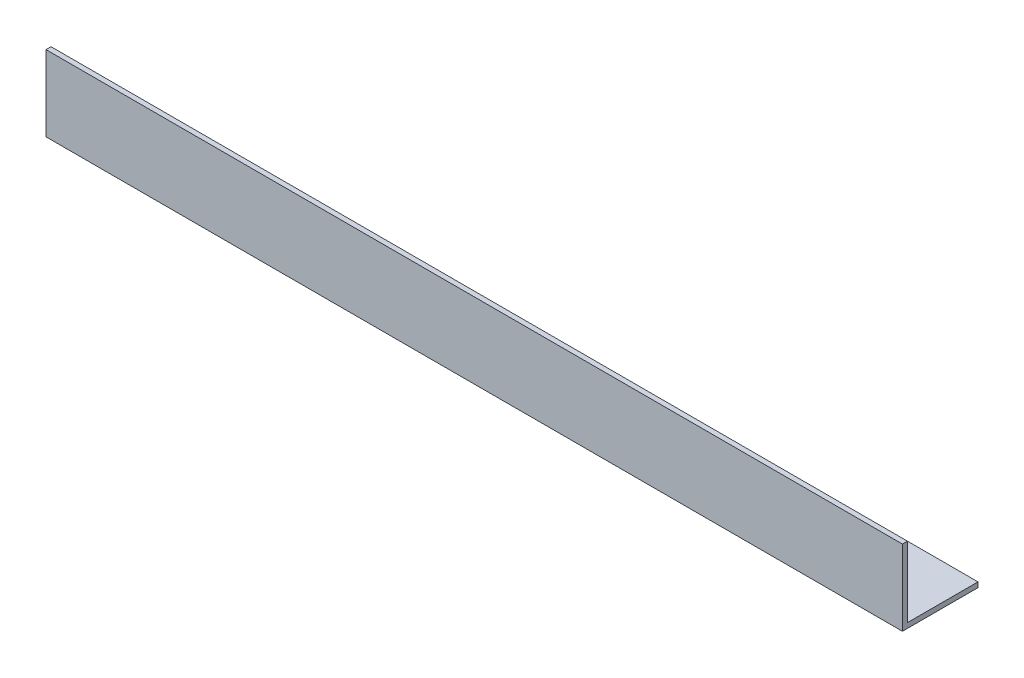
from build123d import *

# Parameters (mm, degrees)
EXTRUDE_1_DEPTH = 510


with BuildPart() as part:
    # Эскиз1 → Вытянуть-Тонкостенный1 (new body)
    with BuildSketch(Plane(origin=(0, 0, 0), x_dir=(0, 0, -1), z_dir=(1, 0, 0))):
        Polygon((45, 0), (0, 0), (0, 45), (3, 45), (3, 3), (45, 3), align=None)
    extrude(amount=EXTRUDE_1_DEPTH)


solid = part.part
